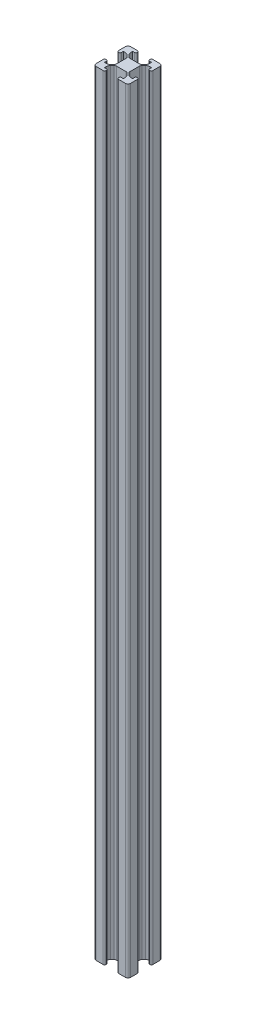
from build123d import *

# Parameters (mm, degrees)
BOSS_EXTRUDE1_DEPTH = 450


with BuildPart() as part:
    # Sketch2 → Boss-Extrude1 (new body)
    with BuildSketch(Plane(origin=(0, 0, 0), x_dir=(1, 0, 0), z_dir=(0, 1, 0))):
        with BuildLine():
            Line((-5.4, 4.869669914), (-4.339339828, 3.809009742))
            ThreePointArc((-4.339339828, 3.809009742), (-4.014180701, 3.322374719), (-3.9, 2.748349571))
            Line((-3.9, 2.748349571), (-3.9, -2.748349571))
            ThreePointArc((-3.9, -2.748349571), (-4.014180701, -3.322374719), (-4.339339828, -3.809009742))
            Line((-4.339339828, -3.809009742), (-5.4, -4.869669914))
            ThreePointArc((-5.4, -4.869669914), (-6.246412561, -5.337861749), (-7.2, -5.5))
            Line((-7.2, -5.5), (-8.2, -5.5))
            Line((-8.2, -5.5), (-8.2, -4.4))
            ThreePointArc((-8.2, -4.4), (-8.434314575, -3.834314575), (-9, -3.6))
            Line((-9, -3.6), (-9.2, -3.6))
            ThreePointArc((-9.2, -3.6), (-9.765685425, -3.834314575), (-10, -4.4))
            Line((-10, -4.4), (-10, -8.5))
            ThreePointArc((-10, -8.5), (-9.560660172, -9.560660172), (-8.5, -10))
            Line((-8.5, -10), (-4.4, -10))
            ThreePointArc((-4.4, -10), (-3.834314575, -9.765685425), (-3.6, -9.2))
            Line((-3.6, -9.2), (-3.6, -9))
            ThreePointArc((-3.6, -9), (-3.834314575, -8.434314575), (-4.4, -8.2))
            Line((-4.4, -8.2), (-5.5, -8.2))
            Line((-5.5, -8.2), (-5.5, -7.2))
            ThreePointArc((-5.5, -7.2), (-5.337861749, -6.246412561), (-4.869669914, -5.4))
            Line((-4.869669914, -5.4), (-3.809009742, -4.339339828))
            ThreePointArc((-3.809009742, -4.339339828), (-3.322374719, -4.014180701), (-2.748349571, -3.9))
            Line((-2.748349571, -3.9), (2.748349571, -3.9))
            ThreePointArc((2.748349571, -3.9), (3.322374719, -4.014180701), (3.809009742, -4.339339828))
            Line((3.809009742, -4.339339828), (4.869669914, -5.4))
            ThreePointArc((4.869669914, -5.4), (5.337861749, -6.246412561), (5.5, -7.2))
            Line((5.5, -7.2), (5.5, -8.2))
            Line((5.5, -8.2), (4.4, -8.2))
            ThreePointArc((4.4, -8.2), (3.834314575, -8.434314575), (3.6, -9))
            Line((3.6, -9), (3.6, -9.2))
            ThreePointArc((3.6, -9.2), (3.834314575, -9.765685425), (4.4, -10))
            Line((4.4, -10), (8.5, -10))
            ThreePointArc((8.5, -10), (9.560660172, -9.560660172), (10, -8.5))
            Line((10, -8.5), (10, -4.4))
            ThreePointArc((10, -4.4), (9.765685425, -3.834314575), (9.2, -3.6))
            Line((9.2, -3.6), (9, -3.6))
            ThreePointArc((9, -3.6), (8.434314575, -3.834314575), (8.2, -4.4))
            Line((8.2, -4.4), (8.2, -5.5))
            Line((8.2, -5.5), (7.2, -5.5))
            ThreePointArc((7.2, -5.5), (6.246412561, -5.337861749), (5.4, -4.869669914))
            Line((5.4, -4.869669914), (4.339339828, -3.809009742))
            ThreePointArc((4.339339828, -3.809009742), (4.014180701, -3.322374719), (3.9, -2.748349571))
            Line((3.9, -2.748349571), (3.9, 2.748349571))
            ThreePointArc((3.9, 2.748349571), (4.014180701, 3.322374719), (4.339339828, 3.809009742))
            Line((4.339339828, 3.809009742), (5.4, 4.869669914))
            ThreePointArc((5.4, 4.869669914), (6.246412561, 5.337861749), (7.2, 5.5))
            Line((7.2, 5.5), (8.2, 5.5))
            Line((8.2, 5.5), (8.2, 4.4))
            ThreePointArc((8.2, 4.4), (8.434314575, 3.834314575), (9, 3.6))
            Line((9, 3.6), (9.2, 3.6))
            ThreePointArc((9.2, 3.6), (9.765685425, 3.834314575), (10, 4.4))
            Line((10, 4.4), (10, 8.5))
            ThreePointArc((10, 8.5), (9.560660172, 9.560660172), (8.5, 10))
            Line((8.5, 10), (4.4, 10))
            ThreePointArc((4.4, 10), (3.834314575, 9.765685425), (3.6, 9.2))
            Line((3.6, 9.2), (3.6, 9))
            ThreePointArc((3.6, 9), (3.834314575, 8.434314575), (4.4, 8.2))
            Line((4.4, 8.2), (5.5, 8.2))
            Line((5.5, 8.2), (5.5, 7.2))
            ThreePointArc((5.5, 7.2), (5.337861749, 6.246412561), (4.869669914, 5.4))
            Line((4.869669914, 5.4), (3.809009742, 4.339339828))
            ThreePointArc((3.809009742, 4.339339828), (3.322374719, 4.014180701), (2.748349571, 3.9))
            Line((2.748349571, 3.9), (-2.748349571, 3.9))
            ThreePointArc((-2.748349571, 3.9), (-3.322374719, 4.014180701), (-3.809009742, 4.339339828))
            Line((-3.809009742, 4.339339828), (-4.869669914, 5.4))
            ThreePointArc((-4.869669914, 5.4), (-5.337861749, 6.246412561), (-5.5, 7.2))
            Line((-5.5, 7.2), (-5.5, 8.2))
            Line((-5.5, 8.2), (-4.4, 8.2))
            ThreePointArc((-4.4, 8.2), (-3.834314575, 8.434314575), (-3.6, 9))
            Line((-3.6, 9), (-3.6, 9.2))
            ThreePointArc((-3.6, 9.2), (-3.834314575, 9.765685425), (-4.4, 10))
            Line((-4.4, 10), (-8.5, 10))
            ThreePointArc((-8.5, 10), (-9.560660172, 9.560660172), (-10, 8.5))
            Line((-10, 8.5), (-10, 4.4))
            ThreePointArc((-10, 4.4), (-9.765685425, 3.834314575), (-9.2, 3.6))
            Line((-9.2, 3.6), (-9, 3.6))
            ThreePointArc((-9, 3.6), (-8.434314575, 3.834314575), (-8.2, 4.4))
            Line((-8.2, 4.4), (-8.2, 5.5))
            Line((-8.2, 5.5), (-7.2, 5.5))
            ThreePointArc((-7.2, 5.5), (-6.246412561, 5.337861749), (-5.4, 4.869669914))
        make_face()
    extrude(amount=BOSS_EXTRUDE1_DEPTH)


solid = part.part
